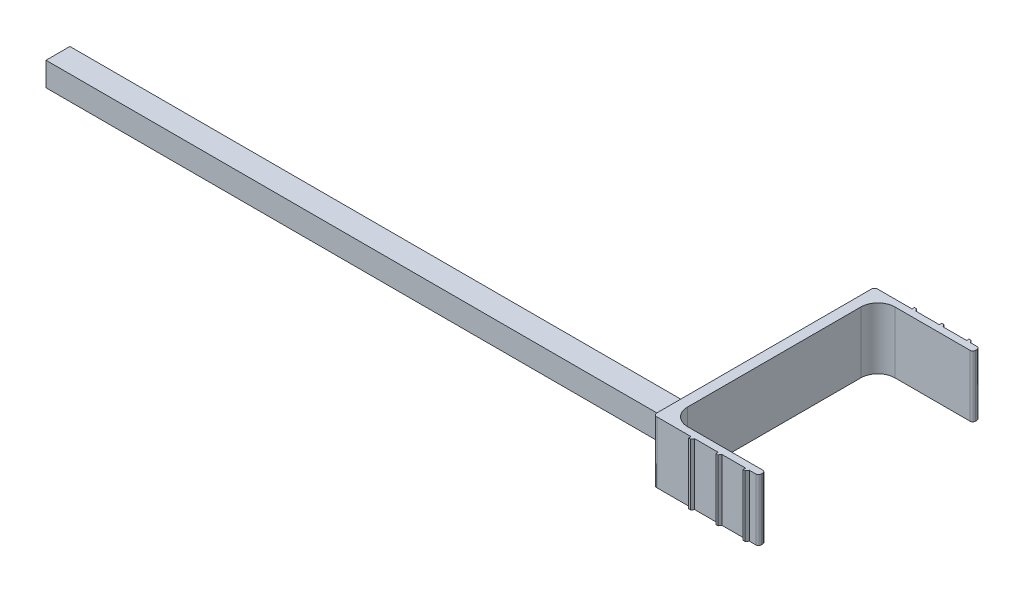
from build123d import *

# Parameters (mm, degrees)
BOSS_EXTRUDE1_DEPTH = 18
FILLET1_R           = 5
FILLET2_R           = 1
SKETCH1_3_W         = 190
SKETCH1_3_H         = 7
BOSS_EXTRUDE2_DEPTH = 7
FILLET3_R           = 10


with BuildPart() as part:
    # Sketch1 → Boss-Extrude1 (new body)
    with BuildSketch(Plane(origin=(0, 0, 0), x_dir=(1, 0, 0), z_dir=(0, 1, 0))):
        with BuildLine():
            Line((7.053352185, -20.387699458), (7.053352185, -32.387699458))
            Line((7.053352185, -32.387699458), (18.053352185, -32.387699458))
            Line((18.053352185, -32.387699458), (18.053352185, -33.087699458))
            Line((18.053352185, -33.087699458), (18.651371079, -33.087699458))
            Line((18.651371079, -33.087699458), (19.151371079, -32.387699458))
            Line((19.151371079, -32.387699458), (26.053352185, -32.387699458))
            Line((26.053352185, -32.387699458), (26.053352185, -33.087699458))
            Line((26.053352185, -33.087699458), (26.651371079, -33.087699458))
            Line((26.651371079, -33.087699458), (27.151371079, -32.387699458))
            Line((27.151371079, -32.387699458), (34.053352185, -32.387699458))
            Line((34.053352185, -32.387699458), (34.053352185, -33.087699458))
            Line((34.053352185, -33.087699458), (34.651371079, -33.087699458))
            Line((34.651371079, -33.087699458), (35.151371079, -32.387699458))
            Line((35.151371079, -32.387699458), (37.053352185, -32.387699458))
            ThreePointArc((37.053352185, -32.387699458), (37.61903761, -32.153384883), (37.853352185, -31.587699458))
            Line((37.853352185, -31.587699458), (37.853352185, -31.187699458))
            ThreePointArc((37.853352185, -31.187699458), (37.61903761, -30.622014033), (37.053352185, -30.387699458))
            Line((37.053352185, -30.387699458), (10.053352185, -30.387699458))
            Line((10.053352185, -30.387699458), (10.053352185, 0))
            Line((10.053352185, 0), (7.053352185, 0))
            Line((7.053352185, 0), (7.053352185, -13.387699458))
            Line((7.053352185, -13.387699458), (7.053352185, -20.387699458))
        make_face()
    extrude(amount=BOSS_EXTRUDE1_DEPTH)

    # Fillet1
    fillet1_edges = [part.edges().sort_by_distance(p)[0] for p in [
        (10.053352185, 9, 30.387699458),
    ]]
    fillet(fillet1_edges, radius=FILLET1_R)

    # Fillet2
    fillet2_edges = [part.edges().sort_by_distance(p)[0] for p in [
        (7.053352185, 9, 32.387699458),
    ]]
    fillet(fillet2_edges, radius=FILLET2_R)

    # Mirror1: part across plane


with BuildPart() as part_1:
    add(part.part)
    add(part.part.mirror(Plane(origin=(0, 18, 0), x_dir=(1, 0, 0), z_dir=(0, 0, -1))))

    # Sketch1<3> → Boss-Extrude2 (add)
    with BuildSketch(Plane(origin=(0, 0, 0), x_dir=(1, 0, 0), z_dir=(0, 1, 0))):
        with Locations((-87.946647815, -16.887699458)):
            Rectangle(SKETCH1_3_W, SKETCH1_3_H)
    extrude(amount=BOSS_EXTRUDE2_DEPTH)

    # Fillet3
    fillet3_edges = [part_1.edges().sort_by_distance(p)[0] for p in [
        (7.053352185, 3.5, 20.387699458),
        (7.053352185, 3.5, 13.387699458),
        (7.053352185, 7, 16.887699458),
    ]]
    fillet(fillet3_edges, radius=FILLET3_R)


solid = part_1.part
